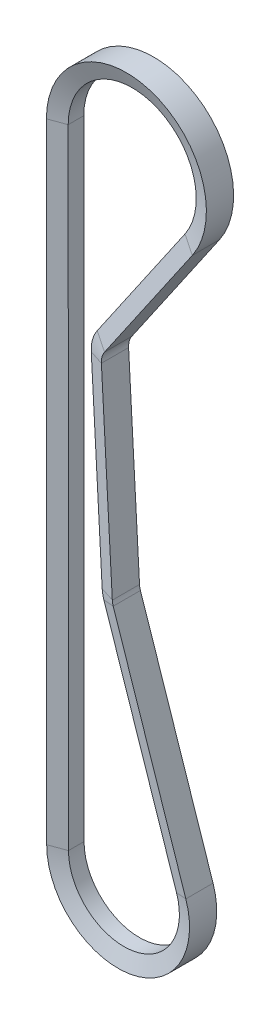
from build123d import *


with BuildPart() as part:
    # Sweep1: sweep along a path in Sketch2
    with BuildLine(Plane.XY) as sweep1_path:
        Line((-24.999997593, -0.010971352), (-25.096536513, 219.968551968))
        ThreePointArc((-25.096536513, 219.968551968), (11.204403664, 246.722087935), (25.974667972, 204.115172573))
        Line((25.974667972, 204.115172573), (-4.744749706, 159.444246608))
        ThreePointArc((-4.744749706, 159.444246608), (-5.625858574, 157.563611227), (-5.853048215, 155.499264566))
        Line((-5.853048215, 155.499264566), (-2.029225467, 85.60378274))
        ThreePointArc((-2.029225467, 85.60378274), (-1.925986617, 84.759507402), (-1.710839605, 83.936603477))
        Line((-1.710839605, 83.936603477), (23.709184434, 7.929348868))
        ThreePointArc((23.709184434, 7.929348868), (4.02227808, -24.674304024), (-24.999997593, -0.010971352))
    # Sketch3 → Sweep1 (sweep)
    with BuildSketch(Plane(origin=(23.709184434, 7.929348868, 0), x_dir=(-0.948367377369935, -0.31717395470068377, 0), z_dir=(0.3171739547006837, -0.9483673773699349, 0))):
        Polygon((0, -4.7625), (0, 4.7625), (5.588, 2.728634331), (5.588, -2.728634331), align=None)
    sweep(path=sweep1_path.line)


solid = part.part
